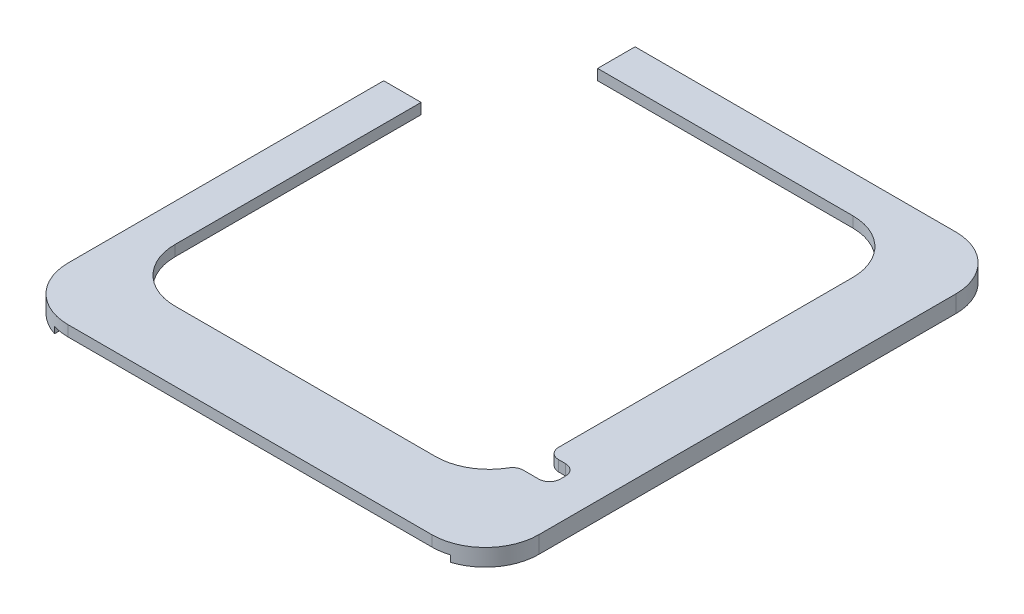
from build123d import *

# Parameters (mm, degrees)
SKETCH_2_W          = 7
SKETCH_2_H          = 10
EXTRUDE_1_DEPTH     = 1.2
SKETCH_2_W_2        = 5
SKETCH_2_H_2        = 7
EXTRUDE_1_2_DEPTH   = 1.2
SKETCH_2_W_3        = 12.3
SKETCH_2_H_3        = 16
EXTRUDE_1_3_DEPTH   = 1.2
EXTRUDE_1_4_DEPTH   = 1.2
EXTRUDE_1_5_DEPTH   = 1.2
EXTRUDE_2_DEPTH     = 2
SKETCH_4_W          = 18
SKETCH_4_H          = 29
CUT_EXTRUDE_1_DEPTH = 124.787075254
FILLET_1_R          = 10
FILLET_2_R          = 10
SKETCH_5_W          = 6.13484861
SKETCH_5_H          = 5
CUT_EXTRUDE_2_DEPTH = 124.787075254
FILLET_3_R          = 2
SKETCH_6_W          = 2.7
SKETCH_6_H          = 72
EXTRUDE_3_DEPTH     = 1.2
CUT_EXTRUDE_5_DEPTH = 0.6


# Some blends are built 0.0001 mm under size
with BuildPart() as part:
    # 草图2 → 凸台-拉伸1 (new body)
    with BuildSketch(Plane(origin=(0, 0, 0), x_dir=(1, 0, 0), z_dir=(0, 1, 0))):
        with Locations((3.5, 63)):
            Rectangle(SKETCH_2_W, SKETCH_2_H)
    extrude(amount=EXTRUDE_1_DEPTH)



with BuildPart() as body_2:
    # 草图2 → Extrude 1 2 (new body)
    with BuildSketch(Plane(origin=(0, 0, 0), x_dir=(1, 0, 0), z_dir=(0, 1, 0))):
        with Locations((15.5, 83.5)):
            Rectangle(SKETCH_2_W_2, SKETCH_2_H_2)
    extrude(amount=EXTRUDE_1_2_DEPTH)


with BuildPart() as body_3:
    # 草图2 → Extrude 1 3 (new body)
    with BuildSketch(Plane(origin=(0, 0, 0), x_dir=(1, 0, 0), z_dir=(0, 1, 0))):
        with Locations((81.85, 79)):
            Rectangle(SKETCH_2_W_3, SKETCH_2_H_3)
    extrude(amount=EXTRUDE_1_3_DEPTH)


with BuildPart() as body_4:
    # 草图2 → Extrude 1 4 (new body)
    with BuildSketch(Plane(origin=(0, 0, 0), x_dir=(1, 0, 0), z_dir=(0, 1, 0))):
        with Locations((3.5, -6)):
            Rectangle(SKETCH_2_W, SKETCH_2_H)
    extrude(amount=EXTRUDE_1_4_DEPTH)


with BuildPart() as body_5:
    # 草图2 → Extrude 1 5 (new body)
    with BuildSketch(Plane(origin=(0, 0, 0), x_dir=(1, 0, 0), z_dir=(0, 1, 0))):
        with Locations((84.5, -6)):
            Rectangle(SKETCH_2_W, SKETCH_2_H)
    extrude(amount=EXTRUDE_1_5_DEPTH)


with BuildPart() as part_1:
    add(part.part)

    add(body_2.part)  # 凸台-拉伸2 merges body 2

    add(body_3.part)  # 凸台-拉伸2 merges body 3

    add(body_4.part)  # 凸台-拉伸2 merges body 4

    add(body_5.part)  # 凸台-拉伸2 merges body 5
    # 草图3 → 凸台-拉伸2 (add)
    with BuildSketch(Plane(origin=(0, 1.2, 0), x_dir=(1, 0, 0), z_dir=(0, 1, 0))):
        Polygon((75.7, 71), (75.7, 2), (7, 2), (7, 58), (7, 68), (0, 68), (0, 58), (0, -1), (0, -11), (11.401754251, -11), (76.788875374, -11), (88, -11), (88, -1), (88, 71), (88, 87), (75.7, 87), (18, 87), (13, 87), (13, 80), (18, 80), (75.7, 80), align=None)
    extrude(amount=EXTRUDE_2_DEPTH)

    # 草图4 → 切除-拉伸1 (cut, through all)
    with BuildSketch(Plane.XZ):
        with Locations((9, -72.5)):
            Rectangle(SKETCH_4_W, SKETCH_4_H)
    extrude(amount=-CUT_EXTRUDE_1_DEPTH, mode=Mode.SUBTRACT)

    # 圆角1
    # the kernel refuses this fillet: 10 mm, written as the material it adds along each edge
    with BuildSketch(Plane(origin=(75.7, 1.2, -80), x_dir=(0, 0, 1), z_dir=(0, 1, 0)), Plane(origin=(7, 1.2, -2), x_dir=(0, 0, -1), z_dir=(0, 1, 0))) as fillet_1_piece_1:
        with BuildLine():
            CenterArc((FILLET_1_R, -FILLET_1_R), FILLET_1_R, 90, 90)
            Line((0, -FILLET_1_R), (0, 0))
            Line((0, 0), (FILLET_1_R, 0))
        make_face()
    extrude(amount=2)
    with BuildSketch(Plane(origin=(75.7, 1.2, -2), x_dir=(0, 0, -1), z_dir=(0, 1, 0))) as fillet_1_piece_2:
        with BuildLine():
            CenterArc((FILLET_1_R, FILLET_1_R), FILLET_1_R, 180, 90)
            Line((0, FILLET_1_R), (0, 0))
            Line((0, 0), (FILLET_1_R, 0))
        make_face()
    extrude(amount=2)

    # 圆角2
    fillet_2_edges = [part_1.edges().sort_by_distance(p)[0] for p in [
        (88, 1.6, -87),
        (0, 1.6, 11),
        (88, 1.6, 11),
    ]]
    fillet(fillet_2_edges, radius=FILLET_2_R - 0.0001)  # a hair under: the kernel refuses the full size

    # 草图5 → 切除-拉伸2 (cut, through all)
    with BuildSketch(Plane(origin=(0, 3.2, 0), x_dir=(1, 0, 0), z_dir=(0, 1, 0))):
        with Locations((77.932575695, 10.5)):
            Rectangle(SKETCH_5_W, SKETCH_5_H)
    extrude(amount=-CUT_EXTRUDE_2_DEPTH, mode=Mode.SUBTRACT)

    # 圆角3
    fillet_3_edges = [part_1.edges().sort_by_distance(p)[0] for p in [
        (74.86515139, 2.2, -8),
        (75.7, 2.2, -13),
        (81, 2.2, -13),
        (81, 2.2, -8),
    ]]
    fillet(fillet_3_edges, radius=FILLET_3_R)

    # 草图6 → 凸台-拉伸3 (add)
    with BuildSketch(Plane.XZ.offset(-1.2)):
        with Locations((86.65, -35)):
            Rectangle(SKETCH_6_W, SKETCH_6_H)
    extrude(amount=EXTRUDE_3_DEPTH)

    # 草图7 → 切除-拉伸5 (cut)
    # profile 1 of 15: a face of its own
    with BuildSketch(Plane(origin=(0, 1.2, 0), x_dir=(1, 0, 0), z_dir=(0, 1, 0))):
        with BuildLine():
            add(Edge.make_bspline(
                [(18.510765161, -2.972730973), (18.559720289, -2.974445621), (18.656752588, -2.977844168), (18.799322395, -3.005212975), (18.935489078, -3.051618244), (19.065369855, -3.114125833), (19.186392288, -3.194167035), (19.300631363, -3.286051516), (19.404471658, -3.393666032), (19.465539281, -3.4735266), (19.496520147, -3.514041514)],
                knots=[0, 0, 0, 0, 1.00426865, 1.990526802, 2.966146487, 3.949964669, 4.940067285, 5.937658965, 6.953731839, 8, 8, 8, 8], degree=3))
            Line((19.496520147, -3.514041514), (19.502218152, -3.448107448))
            Line((19.502218152, -3.448107448), (19.532336182, -3.027269027))
            Line((19.532336182, -3.027269027), (20.243772894, -3.027269027))
            Line((20.243772894, -3.027269027), (20.243772894, -6))
            Line((20.243772894, -6), (19.48024013, -6))
            Line((19.48024013, -6), (19.48024013, -4.214082214))
            add(Edge.make_bspline(
                [(19.48024013, -4.214082214), (19.461661523, -4.17404989), (19.425521948, -4.096178003), (19.351542282, -3.992712809), (19.262949694, -3.904370689), (19.192020907, -3.861876103), (19.156267806, -3.84045584)],
                knots=[0, 0, 0, 0, 1.048167327, 2.038921516, 3.011478428, 4, 4, 4, 4], degree=3))
            add(Edge.make_bspline(
                [(19.156267806, -3.84045584), (19.123316176, -3.824194422), (19.055098378, -3.790529374), (18.939902405, -3.759326253), (18.812108312, -3.739472931), (18.722221022, -3.737366034), (18.675193325, -3.736263736)],
                knots=[0, 0, 0, 0, 0.885042727, 1.832251298, 2.865866045, 4, 4, 4, 4], degree=3))
            add(Edge.make_bspline(
                [(18.675193325, -3.736263736), (18.626316777, -3.736944957), (18.525932536, -3.738344071), (18.37362468, -3.753505421), (18.218629542, -3.773754972), (18.116381034, -3.79655268), (18.065506716, -3.807895808)],
                knots=[0, 0, 0, 0, 0.95309603, 1.957499557, 2.983742445, 4, 4, 4, 4], degree=3))
            Line((18.065506716, -3.807895808), (17.953174603, -3.046805047))
            add(Edge.make_bspline(
                [(17.953174603, -3.046805047), (17.96941445, -3.042042863), (18.003845981, -3.031946138), (18.059829051, -3.019011415), (18.122867513, -3.007069657), (18.218173767, -2.991672191), (18.347989978, -2.975126447), (18.455073508, -2.973550557), (18.510765161, -2.972730973)],
                knots=[0, 0, 0, 0, 0.539787281, 1.144450548, 1.831968336, 2.586160082, 4.224541291, 6, 6, 6, 6], degree=3))
        make_face()
    # profile 2 of 15: a face of its own
    with BuildSketch(Plane(origin=(0, 1.2, 0), x_dir=(1, 0, 0), z_dir=(0, 1, 0))):
        with BuildLine():
            add(Edge.make_bspline(
                [(22.588909239, -6.054538055), (22.553618335, -6.054157216), (22.484023978, -6.053406195), (22.38133849, -6.044816418), (22.282162968, -6.031961653), (22.186605903, -6.014386772), (22.095144466, -5.990369526), (22.006863525, -5.962136795), (21.922336853, -5.927932598), (21.816969586, -5.876487618), (21.697149892, -5.806201812), (21.570402311, -5.715312657), (21.463182677, -5.620161615), (21.407123996, -5.548543266), (21.38011803, -5.514041514)],
                knots=[0, 0, 0, 0, 0.925770377, 1.825637414, 2.701643766, 3.549213054, 4.372883542, 5.181148833, 5.9796667, 6.762964154, 8.25629436, 9.617741739, 10.852359996, 12, 12, 12, 12], degree=3))
            Line((21.38011803, -5.514041514), (21.761884412, -5.101343101))
            add(Edge.make_bspline(
                [(21.761884412, -5.101343101), (21.784807361, -5.128577298), (21.83066927, -5.183064716), (21.912189827, -5.253571185), (22.004342703, -5.312275396), (22.104875652, -5.35996595), (22.211257521, -5.395587158), (22.319938962, -5.423313107), (22.430829257, -5.43863343), (22.505296728, -5.441151206), (22.542511193, -5.442409442)],
                knots=[0, 0, 0, 0, 0.968292131, 1.93726064, 2.921075072, 3.935732918, 4.959203909, 5.971734107, 6.986391953, 8, 8, 8, 8], degree=3))
            add(Edge.make_bspline(
                [(22.542511193, -5.442409442), (22.568584647, -5.441739951), (22.619801317, -5.440424855), (22.695277235, -5.431340931), (22.767593799, -5.416183807), (22.836416965, -5.393881853), (22.901627885, -5.366036445), (22.963561334, -5.33359838), (23.021913166, -5.296014796), (23.057743891, -5.267181823), (23.075681726, -5.252747253)],
                knots=[0, 0, 0, 0, 1.08232958, 2.12604423, 3.151174937, 4.145070927, 5.124239811, 6.091675454, 7.044640867, 8, 8, 8, 8], degree=3))
            add(Edge.make_bspline(
                [(23.075681726, -5.252747253), (23.107244847, -5.222883892), (23.169211591, -5.164254227), (23.229954033, -5.075154542), (23.268024362, -4.996139378), (23.29378016, -4.928240963), (23.317479829, -4.851912679), (23.329763293, -4.797549562), (23.336161986, -4.769230769)],
                knots=[0, 0, 0, 0, 1.393511036, 2.735830271, 3.433894047, 4.209552534, 5.067321514, 6, 6, 6, 6], degree=3))
            Line((23.336161986, -4.769230769), (23.336161986, -4.761090761))
            Line((23.336161986, -4.761090761), (21.31988197, -4.761090761))
            Line((21.31988197, -4.761090761), (21.31988197, -4.437118437))
            add(Edge.make_bspline(
                [(21.31988197, -4.437118437), (21.320927303, -4.383617997), (21.322975784, -4.278776164), (21.340475434, -4.125242278), (21.368685905, -3.978963656), (21.408589767, -3.840336473), (21.459097506, -3.709887759), (21.519022489, -3.588166735), (21.589828116, -3.476062006), (21.646049765, -3.409522374), (21.673972324, -3.376475376)],
                knots=[0, 0, 0, 0, 1.122970953, 2.20062363, 3.239654839, 4.247531543, 5.225053915, 6.172790854, 7.092514104, 8, 8, 8, 8], degree=3))
            add(Edge.make_bspline(
                [(21.673972324, -3.376475376), (21.704305049, -3.345718659), (21.765035725, -3.284139085), (21.867244724, -3.203051029), (21.980226962, -3.134786537), (22.101405937, -3.075713934), (22.232190822, -3.029430583), (22.371779466, -2.995815091), (22.520250576, -2.976335204), (22.622225885, -2.973950557), (22.674379324, -2.972730973)],
                knots=[0, 0, 0, 0, 0.932380712, 1.866766408, 2.808455035, 3.778168738, 4.773465388, 5.798203766, 6.873930868, 8, 8, 8, 8], degree=3))
            add(Edge.make_bspline(
                [(22.674379324, -2.972730973), (22.725172755, -2.97427861), (22.825270503, -2.977328513), (22.972603339, -2.997280297), (23.113464729, -3.034173844), (23.248559801, -3.082226797), (23.375820288, -3.144758518), (23.495040225, -3.217827187), (23.605400482, -3.30299039), (23.671094178, -3.368161637), (23.704090354, -3.400895401)],
                knots=[0, 0, 0, 0, 1.063104521, 2.095041956, 3.103191733, 4.105503437, 5.090878926, 6.064799998, 7.028001121, 8, 8, 8, 8], degree=3))
            add(Edge.make_bspline(
                [(23.704090354, -3.400895401), (23.735245376, -3.435818862), (23.797839922, -3.505984701), (23.878384021, -3.623334427), (23.947475523, -3.75054956), (24.007291727, -3.886023684), (24.053644938, -4.03093962), (24.086554525, -4.183327426), (24.107813945, -4.34318232), (24.109983083, -4.452243865), (24.111090761, -4.507936508)],
                knots=[0, 0, 0, 0, 0.928831954, 1.866145857, 2.818826586, 3.801047347, 4.803173288, 5.834887371, 6.894377997, 8, 8, 8, 8], degree=3))
            Line((24.111090761, -4.507936508), (24.111090761, -4.617826618))
            add(Edge.make_bspline(
                [(24.111090761, -4.617826618), (24.109917744, -4.667007757), (24.107593788, -4.764444375), (24.086657457, -4.908193557), (24.052328574, -5.047155013), (24.005192321, -5.180878312), (23.945365531, -5.307611015), (23.872523016, -5.425660045), (23.790413139, -5.536521113), (23.72580166, -5.601857835), (23.693508344, -5.634513635)],
                knots=[0, 0, 0, 0, 1.044469973, 2.069281507, 3.078785392, 4.081617092, 5.076997636, 6.049887288, 7.025318574, 8, 8, 8, 8], degree=3))
            add(Edge.make_bspline(
                [(23.693508344, -5.634513635), (23.659236281, -5.666344326), (23.590388788, -5.730287465), (23.472943436, -5.810509869), (23.348442866, -5.884276626), (23.21287286, -5.944803926), (23.068612283, -5.994047409), (22.915553716, -6.028690023), (22.754770975, -6.050357271), (22.644873951, -6.053127384), (22.588909239, -6.054538055)],
                knots=[0, 0, 0, 0, 0.925143054, 1.85847523, 2.80967551, 3.788571406, 4.792920861, 5.824070915, 6.891914993, 8, 8, 8, 8], degree=3))
        make_face()
        with BuildLine():
            add(Edge.make_bspline(
                [(22.68007733, -3.590557591), (22.656431556, -3.590838025), (22.610312683, -3.591384986), (22.543701572, -3.60106504), (22.480899334, -3.614152188), (22.405664823, -3.64164817), (22.318846232, -3.683835886), (22.262373462, -3.733842293), (22.234818885, -3.758241758)],
                knots=[0, 0, 0, 0, 0.870796138, 1.698406502, 2.477437244, 3.230406908, 4.648641342, 6, 6, 6, 6], degree=3))
            add(Edge.make_bspline(
                [(22.234818885, -3.758241758), (22.210434229, -3.786097085), (22.161006114, -3.842560307), (22.110887277, -3.944837852), (22.074706964, -4.05566619), (22.071304576, -4.133735653), (22.06957672, -4.173382173)],
                knots=[0, 0, 0, 0, 0.966911438, 1.959946007, 2.963986173, 4, 4, 4, 4], degree=3))
            Line((22.06957672, -4.173382173), (22.06957672, -4.233618234))
            Line((22.06957672, -4.233618234), (23.322323972, -4.233618234))
            add(Edge.make_bspline(
                [(23.322323972, -4.233618234), (23.312077642, -4.18689831), (23.292309908, -4.09676389), (23.244788013, -3.970631439), (23.182854267, -3.859144786), (23.128867948, -3.796787646), (23.102543753, -3.766381766)],
                knots=[0, 0, 0, 0, 1.095344216, 2.11319302, 3.079976638, 4, 4, 4, 4], degree=3))
            add(Edge.make_bspline(
                [(23.102543753, -3.766381766), (23.08891906, -3.752867836), (23.061725628, -3.725895474), (23.017239598, -3.689460253), (22.967601346, -3.660858416), (22.916033632, -3.634931487), (22.860994069, -3.61448549), (22.802640309, -3.601253804), (22.742271339, -3.591433012), (22.701011997, -3.59085226), (22.68007733, -3.590557591)],
                knots=[0, 0, 0, 0, 0.977751909, 1.951488393, 2.9188248, 3.889514203, 4.891116046, 5.900416418, 6.934687739, 8, 8, 8, 8], degree=3))
        make_face(mode=Mode.SUBTRACT)
    # profile 3 of 15: a face of its own
    with BuildSketch(Plane(origin=(0, 1.2, 0), x_dir=(1, 0, 0), z_dir=(0, 1, 0))):
        Polygon((26.057366707, -3.956043956), (26.70042735, -3.027269027), (27.521754172, -3.027269027), (26.527859178, -4.485958486), (27.560826211, -6), (26.733801384, -6), (26.054924705, -5.027269027), (25.371164021, -6), (24.546581197, -6), (25.57954823, -4.485958486), (24.582397232, -3.027269027), (25.403724054, -3.027269027), align=None)
    # profile 4 of 15: a face of its own
    with BuildSketch(Plane(origin=(0, 1.2, 0), x_dir=(1, 0, 0), z_dir=(0, 1, 0))):
        Polygon((30.60030525, -3.027269027), (30.60030525, -3.650793651), (29.754558405, -3.650793651), (29.754558405, -5.378917379), (30.60030525, -5.378917379), (30.60030525, -6), (28.177838828, -6), (28.177838828, -5.378917379), (28.982071632, -5.378917379), (28.982071632, -3.027269027), align=None)
    # profile 5 of 15: a face of its own
    with BuildSketch(Plane(origin=(0, 1.2, 0), x_dir=(1, 0, 0), z_dir=(0, 1, 0))):
        with BuildLine():
            add(Edge.make_bspline(
                [(29.809096459, -2.266178266), (29.807460751, -2.294559154), (29.804244432, -2.350364952), (29.781031209, -2.430014106), (29.743400517, -2.501432654), (29.706687435, -2.539071821), (29.688624339, -2.557590558)],
                knots=[0, 0, 0, 0, 1.049081676, 2.062826266, 3.046896788, 4, 4, 4, 4], degree=3))
            add(Edge.make_bspline(
                [(29.688624339, -2.557590558), (29.668089813, -2.574809184), (29.626184314, -2.609947816), (29.549242843, -2.646140932), (29.462623517, -2.669563341), (29.40117364, -2.671949931), (29.36953602, -2.673178673)],
                knots=[0, 0, 0, 0, 0.922264153, 1.882095614, 2.90959169, 4, 4, 4, 4], degree=3))
            add(Edge.make_bspline(
                [(29.36953602, -2.673178673), (29.337406319, -2.671803169), (29.275644856, -2.6691591), (29.187999523, -2.648207477), (29.111181043, -2.611459071), (29.045586341, -2.561732467), (28.993046962, -2.500178723), (28.954937076, -2.429461897), (28.931115987, -2.350439272), (28.928752169, -2.294840462), (28.927533578, -2.266178266)],
                knots=[0, 0, 0, 0, 1.141013215, 2.193317794, 3.176571943, 4.146547589, 5.097162428, 6.029011987, 6.983919884, 8, 8, 8, 8], degree=3))
            add(Edge.make_bspline(
                [(28.927533578, -2.266178266), (28.928717939, -2.237506599), (28.931004584, -2.182150272), (28.955121849, -2.103495176), (28.993030473, -2.032987202), (29.045590894, -1.971439339), (29.111179797, -1.921711114), (29.187999883, -1.884963157), (29.275644755, -1.864011405), (29.337406284, -1.861367354), (29.36953602, -1.85999186)],
                knots=[0, 0, 0, 0, 1.017255597, 1.964013175, 2.896940771, 3.848655357, 4.819753147, 5.804144802, 6.85766677, 8, 8, 8, 8], degree=3))
            add(Edge.make_bspline(
                [(29.36953602, -1.85999186), (29.401176356, -1.861208661), (29.462631508, -1.86357206), (29.54909903, -1.887125876), (29.625623725, -1.922470922), (29.668006365, -1.956008752), (29.688624339, -1.972323972)],
                knots=[0, 0, 0, 0, 1.096149104, 2.129054753, 3.089837262, 4, 4, 4, 4], degree=3))
            add(Edge.make_bspline(
                [(29.688624339, -1.972323972), (29.706650771, -1.991706238), (29.743018659, -2.030809488), (29.780742865, -2.102697181), (29.80436412, -2.182229884), (29.807496141, -2.237789744), (29.809096459, -2.266178266)],
                knots=[0, 0, 0, 0, 0.970522286, 1.958005104, 2.956634926, 4, 4, 4, 4], degree=3))
        make_face()
    # profile 6 of 15: a face of its own
    with BuildSketch(Plane(origin=(0, 1.2, 0), x_dir=(1, 0, 0), z_dir=(0, 1, 0))):
        Polygon((31.678856329, -4.343508344), (31.678856329, -3.716727717), (33.393142043, -3.716727717), (33.393142043, -2.629222629), (31.464774115, -2.629222629), (31.464774115, -2), (34.168070818, -2), (34.168070818, -6), (33.393142043, -6), (33.393142043, -4.343508344), align=None)
    # profile 7 of 15: a face of its own
    with BuildSketch(Plane(origin=(0, 1.2, 0), x_dir=(1, 0, 0), z_dir=(0, 1, 0))):
        with BuildLine():
            Line((41.042307692, -4.491656492), (41.042307692, -4.549450549))
            add(Edge.make_bspline(
                [(41.042307692, -4.549450549), (41.041504315, -4.60240662), (41.039922822, -4.706653572), (41.02341922, -4.859911099), (40.999885109, -5.007848488), (40.96454665, -5.148894135), (40.921438116, -5.282751206), (40.867113009, -5.406541235), (40.80579095, -5.521940826), (40.756519444, -5.591836661), (40.732173382, -5.626373626)],
                knots=[0, 0, 0, 0, 1.114797151, 2.194539839, 3.242921125, 4.267103555, 5.253726722, 6.200630871, 7.110894805, 8, 8, 8, 8], degree=3))
            add(Edge.make_bspline(
                [(40.732173382, -5.626373626), (40.706553866, -5.658469053), (40.655771003, -5.722088427), (40.567666878, -5.806118931), (40.471910361, -5.879795505), (40.368403908, -5.943131585), (40.256445256, -5.992724704), (40.137359517, -6.028924276), (40.010925171, -6.05034258), (39.924224303, -6.053119082), (39.87991453, -6.054538055)],
                knots=[0, 0, 0, 0, 0.994172767, 1.970643712, 2.941142302, 3.917613248, 4.90359979, 5.899857416, 6.926690765, 8, 8, 8, 8], degree=3))
            add(Edge.make_bspline(
                [(39.87991453, -6.054538055), (39.839392861, -6.053686656), (39.760329265, -6.052025456), (39.646174838, -6.032078818), (39.538752462, -6.00377447), (39.439797642, -5.960336884), (39.347287486, -5.907310735), (39.261677866, -5.844093026), (39.181601532, -5.77216544), (39.134533786, -5.717543535), (39.110683761, -5.68986569)],
                knots=[0, 0, 0, 0, 1.101140162, 2.148482586, 3.144267539, 4.11648798, 5.078821032, 6.040020862, 7.006845344, 8, 8, 8, 8], degree=3))
            Line((39.110683761, -5.68986569), (39.072425722, -6))
            Line((39.072425722, -6), (38.382967033, -6))
            Line((38.382967033, -6), (38.382967033, -1.78021978))
            Line((38.382967033, -1.78021978), (39.1497558, -1.78021978))
            Line((39.1497558, -1.78021978), (39.1497558, -3.294261294))
            add(Edge.make_bspline(
                [(39.1497558, -3.294261294), (39.172928259, -3.269676898), (39.218819958, -3.220988943), (39.29471571, -3.156154532), (39.376954606, -3.101771468), (39.463424638, -3.054684572), (39.556435291, -3.017442623), (39.656614482, -2.991996855), (39.763469596, -2.974890318), (39.837245019, -2.973462339), (39.875030525, -2.972730973)],
                knots=[0, 0, 0, 0, 0.989130309, 1.958914611, 2.915551243, 3.872055815, 4.838708826, 5.84109621, 6.894275772, 8, 8, 8, 8], degree=3))
            add(Edge.make_bspline(
                [(39.875030525, -2.972730973), (39.919899875, -2.973758024), (40.007725851, -2.975768344), (40.135396097, -2.998088775), (40.255999263, -3.031511146), (40.368142981, -3.080545199), (40.473076258, -3.140394485), (40.568394361, -3.214206577), (40.657658342, -3.296974197), (40.708775738, -3.360595214), (40.734615385, -3.392755393)],
                knots=[0, 0, 0, 0, 1.082656768, 2.119161275, 3.121130112, 4.098731911, 5.067728088, 6.031167411, 7.004762719, 8, 8, 8, 8], degree=3))
            add(Edge.make_bspline(
                [(40.734615385, -3.392755393), (40.758997308, -3.427269646), (40.808617268, -3.497510037), (40.869700934, -3.614088965), (40.922786467, -3.739880071), (40.966485567, -3.874984524), (41.000611841, -4.018719108), (41.024604493, -4.170017761), (41.039667453, -4.328550921), (41.041415524, -4.43654117), (41.042307692, -4.491656492)],
                knots=[0, 0, 0, 0, 0.873127021, 1.776911794, 2.714907838, 3.694466646, 4.709825059, 5.767055702, 6.860365238, 8, 8, 8, 8], degree=3))
        make_face()
        with BuildLine():
            Line((40.278774929, -4.549450549), (40.278774929, -4.491656492))
            add(Edge.make_bspline(
                [(40.278774929, -4.491656492), (40.277297379, -4.431335564), (40.274422551, -4.313970753), (40.253614283, -4.170732213), (40.228928073, -4.063099027), (40.204249265, -3.988771212), (40.176221381, -3.918692538), (40.152753481, -3.875528011), (40.141208791, -3.854293854)],
                knots=[0, 0, 0, 0, 1.64659124, 3.2037284, 3.94238429, 4.659391249, 5.340507156, 6, 6, 6, 6], degree=3))
            add(Edge.make_bspline(
                [(40.141208791, -3.854293854), (40.128904892, -3.834981295), (40.10449249, -3.796662876), (40.060442884, -3.745443866), (40.010715548, -3.700885388), (39.956116594, -3.662340897), (39.895553646, -3.630874978), (39.828680091, -3.609342029), (39.756285154, -3.594615519), (39.70579777, -3.593550662), (39.67967033, -3.592999593)],
                knots=[0, 0, 0, 0, 0.985881017, 1.956105478, 2.899972441, 3.856930312, 4.829617722, 5.827970456, 6.875965264, 8, 8, 8, 8], degree=3))
            add(Edge.make_bspline(
                [(39.67967033, -3.592999593), (39.648380643, -3.593702227), (39.588047977, -3.595057042), (39.502128104, -3.61195482), (39.424193174, -3.637654069), (39.35475708, -3.674903798), (39.293399981, -3.722344224), (39.237658315, -3.776841549), (39.188766743, -3.840405743), (39.162963108, -3.887819631), (39.1497558, -3.912087912)],
                knots=[0, 0, 0, 0, 1.144389556, 2.206608035, 3.193396821, 4.140402505, 5.076552545, 6.025225311, 6.989233137, 8, 8, 8, 8], degree=3))
            Line((39.1497558, -3.912087912), (39.1497558, -5.115181115))
            add(Edge.make_bspline(
                [(39.1497558, -5.115181115), (39.162981444, -5.138908576), (39.189119448, -5.185801452), (39.238526681, -5.248522806), (39.294214624, -5.303635758), (39.356664259, -5.350625648), (39.426782498, -5.388916488), (39.505756596, -5.415643217), (39.593073223, -5.430879189), (39.653832466, -5.433111038), (39.685368335, -5.434269434)],
                knots=[0, 0, 0, 0, 0.987352076, 1.951316178, 2.89400397, 3.832129172, 4.78653676, 5.788983242, 6.85241598, 8, 8, 8, 8], degree=3))
            add(Edge.make_bspline(
                [(39.685368335, -5.434269434), (39.711483854, -5.433642569), (39.761898135, -5.432432447), (39.834322953, -5.418768328), (39.900975359, -5.398152216), (39.961228004, -5.367456203), (40.01477676, -5.328758763), (40.063765118, -5.28427155), (40.106896529, -5.23279122), (40.131302405, -5.194693224), (40.143650794, -5.175417175)],
                knots=[0, 0, 0, 0, 1.13071954, 2.18277929, 3.183412007, 4.146061051, 5.099104669, 6.039874946, 7.0082558, 8, 8, 8, 8], degree=3))
            add(Edge.make_bspline(
                [(40.143650794, -5.175417175), (40.155155387, -5.154991569), (40.178538038, -5.113477296), (40.207139741, -5.046178885), (40.229338207, -4.973384293), (40.255004992, -4.868132014), (40.274006828, -4.725934504), (40.277153322, -4.609471844), (40.278774929, -4.549450549)],
                knots=[0, 0, 0, 0, 0.651061411, 1.323257734, 2.026693217, 2.763633848, 4.332075826, 6, 6, 6, 6], degree=3))
        make_face(mode=Mode.SUBTRACT)
    # profile 8 of 15: a face of its own
    with BuildSketch(Plane(origin=(0, 1.2, 0), x_dir=(1, 0, 0), z_dir=(0, 1, 0))):
        Polygon((44.145278795, -3.027269027), (44.145278795, -3.650793651), (43.29953195, -3.650793651), (43.29953195, -5.378917379), (44.145278795, -5.378917379), (44.145278795, -6), (41.722812373, -6), (41.722812373, -5.378917379), (42.527045177, -5.378917379), (42.527045177, -3.027269027), align=None)
    # profile 9 of 15: a face of its own
    with BuildSketch(Plane(origin=(0, 1.2, 0), x_dir=(1, 0, 0), z_dir=(0, 1, 0))):
        with BuildLine():
            add(Edge.make_bspline(
                [(43.354070004, -2.266178266), (43.352434296, -2.294559154), (43.349217977, -2.350364952), (43.326004754, -2.430014106), (43.288374062, -2.501432654), (43.25166098, -2.539071821), (43.233597884, -2.557590558)],
                knots=[0, 0, 0, 0, 1.049081676, 2.062826266, 3.046896788, 4, 4, 4, 4], degree=3))
            add(Edge.make_bspline(
                [(43.233597884, -2.557590558), (43.213063358, -2.574809184), (43.171157859, -2.609947816), (43.094216388, -2.646140932), (43.007597062, -2.669563341), (42.946147185, -2.671949931), (42.914509565, -2.673178673)],
                knots=[0, 0, 0, 0, 0.922264153, 1.882095614, 2.90959169, 4, 4, 4, 4], degree=3))
            add(Edge.make_bspline(
                [(42.914509565, -2.673178673), (42.882379864, -2.671803169), (42.820618401, -2.6691591), (42.732973068, -2.648207477), (42.656154588, -2.611459071), (42.590559886, -2.561732467), (42.538020507, -2.500178723), (42.499910621, -2.429461897), (42.476089532, -2.350439272), (42.473725714, -2.294840462), (42.472507123, -2.266178266)],
                knots=[0, 0, 0, 0, 1.141013215, 2.193317794, 3.176571943, 4.146547589, 5.097162428, 6.029011987, 6.983919884, 8, 8, 8, 8], degree=3))
            add(Edge.make_bspline(
                [(42.472507123, -2.266178266), (42.473691484, -2.237506599), (42.475978129, -2.182150272), (42.500095394, -2.103495176), (42.538004018, -2.032987202), (42.590564439, -1.971439339), (42.656153342, -1.921711114), (42.732973428, -1.884963157), (42.8206183, -1.864011405), (42.882379829, -1.861367354), (42.914509565, -1.85999186)],
                knots=[0, 0, 0, 0, 1.017255597, 1.964013175, 2.896940771, 3.848655357, 4.819753147, 5.804144802, 6.85766677, 8, 8, 8, 8], degree=3))
            add(Edge.make_bspline(
                [(42.914509565, -1.85999186), (42.946149901, -1.861208661), (43.007605053, -1.86357206), (43.094072575, -1.887125876), (43.17059727, -1.922470922), (43.21297991, -1.956008752), (43.233597884, -1.972323972)],
                knots=[0, 0, 0, 0, 1.096149104, 2.129054753, 3.089837262, 4, 4, 4, 4], degree=3))
            add(Edge.make_bspline(
                [(43.233597884, -1.972323972), (43.251624316, -1.991706238), (43.287992204, -2.030809488), (43.32571641, -2.102697181), (43.349337665, -2.182229884), (43.352469686, -2.237789744), (43.354070004, -2.266178266)],
                knots=[0, 0, 0, 0, 0.970522286, 1.958005104, 2.956634926, 4, 4, 4, 4], degree=3))
        make_face()
    # profile 10 of 15: a face of its own
    with BuildSketch(Plane(origin=(0, 1.2, 0), x_dir=(1, 0, 0), z_dir=(0, 1, 0))):
        with BuildLine():
            Line((47.839214489, -4.485958486), (47.839214489, -4.543752544))
            add(Edge.make_bspline(
                [(47.839214489, -4.543752544), (47.838269542, -4.597266083), (47.836412475, -4.702434069), (47.817318408, -4.856873271), (47.789884343, -5.005282005), (47.748714789, -5.146547686), (47.697045984, -5.280362373), (47.633260237, -5.405098328), (47.55912085, -5.521543787), (47.500568521, -5.591425386), (47.471286121, -5.626373626)],
                knots=[0, 0, 0, 0, 1.097957229, 2.157770801, 3.190062059, 4.19308757, 5.173638154, 6.130181546, 7.064891673, 8, 8, 8, 8], degree=3))
            add(Edge.make_bspline(
                [(47.471286121, -5.626373626), (47.440583598, -5.659209546), (47.37913541, -5.724927525), (47.272568165, -5.809126109), (47.157216378, -5.884222956), (47.030751443, -5.946748464), (46.894298608, -5.99647001), (46.748353077, -6.032366187), (46.593331578, -6.053566069), (46.486954007, -6.056364661), (46.432621083, -6.057794058)],
                knots=[0, 0, 0, 0, 0.928831053, 1.858967251, 2.800969092, 3.772479409, 4.770483341, 5.799728561, 6.876199351, 8, 8, 8, 8], degree=3))
            add(Edge.make_bspline(
                [(46.432621083, -6.057794058), (46.378554154, -6.056400271), (46.273244263, -6.053685496), (46.119628682, -6.032156441), (45.975218709, -5.996634497), (45.839928798, -5.94661418), (45.714260596, -5.883776686), (45.598460559, -5.809411621), (45.491827324, -5.724891951), (45.43036409, -5.659197694), (45.39965405, -5.626373626)],
                knots=[0, 0, 0, 0, 1.123611424, 2.188535583, 3.217293366, 4.20954456, 5.1807142, 6.132024807, 7.066668138, 8, 8, 8, 8], degree=3))
            add(Edge.make_bspline(
                [(45.39965405, -5.626373626), (45.370964927, -5.591381329), (45.313477895, -5.521264047), (45.240021005, -5.405112944), (45.17732685, -5.280143711), (45.125353307, -5.146589623), (45.084591352, -5.005169926), (45.055772443, -4.85698429), (45.03704807, -4.702418434), (45.035139062, -4.59726081), (45.034167684, -4.543752544)],
                knots=[0, 0, 0, 0, 0.92950485, 1.862534265, 2.817920483, 3.799868555, 4.804323587, 5.839153926, 6.900477953, 8, 8, 8, 8], degree=3))
            Line((45.034167684, -4.543752544), (45.034167684, -4.485958486))
            add(Edge.make_bspline(
                [(45.034167684, -4.485958486), (45.035149939, -4.432993515), (45.037085036, -4.328649528), (45.055753245, -4.175158882), (45.084706621, -4.027549615), (45.12534258, -3.886375183), (45.177329613, -3.752823896), (45.240020296, -3.627853942), (45.31347807, -3.511703022), (45.370964985, -3.441585716), (45.39965405, -3.406593407)],
                knots=[0, 0, 0, 0, 1.091396696, 2.150113154, 3.182331507, 4.1895766, 5.174252216, 6.132292198, 7.067913277, 8, 8, 8, 8], degree=3))
            add(Edge.make_bspline(
                [(45.39965405, -3.406593407), (45.431024145, -3.373899853), (45.493661657, -3.308619755), (45.599842199, -3.22233426), (45.716634057, -3.148663321), (45.842687938, -3.085421285), (45.978219885, -3.034909039), (46.123274716, -2.997940643), (46.27788856, -2.976980094), (46.383989921, -2.974169921), (46.438319088, -2.972730973)],
                knots=[0, 0, 0, 0, 0.936395595, 1.869726278, 2.820835012, 3.78697061, 4.781292913, 5.806086311, 6.876607213, 8, 8, 8, 8], degree=3))
            add(Edge.make_bspline(
                [(46.438319088, -2.972730973), (46.492649178, -2.974167493), (46.59875234, -2.976972923), (46.753353343, -2.997967279), (46.898207254, -3.034752279), (47.033122597, -3.0854797), (47.158293334, -3.148411391), (47.273631546, -3.222648105), (47.378914004, -3.308376206), (47.440500849, -3.373860117), (47.471286121, -3.406593407)],
                knots=[0, 0, 0, 0, 1.127899569, 2.202715142, 3.231619765, 4.22465531, 5.18963108, 6.135068752, 7.067781155, 8, 8, 8, 8], degree=3))
            add(Edge.make_bspline(
                [(47.471286121, -3.406593407), (47.500568465, -3.441541658), (47.559120682, -3.51142328), (47.633260912, -3.62786857), (47.697043358, -3.752605187), (47.748724958, -3.886417309), (47.789770404, -4.027436721), (47.817337964, -4.175270422), (47.836374982, -4.328633917), (47.838258444, -4.432988258), (47.839214489, -4.485958486)],
                knots=[0, 0, 0, 0, 0.937702725, 1.875006145, 2.834203406, 3.817474464, 4.823282805, 5.852953804, 6.910160091, 8, 8, 8, 8], degree=3))
        make_face()
        with BuildLine():
            Line((47.075681726, -4.543752544), (47.075681726, -4.485958486))
            add(Edge.make_bspline(
                [(47.075681726, -4.485958486), (47.074053931, -4.427240102), (47.070863375, -4.312149247), (47.047585137, -4.171435023), (47.021125765, -4.064864787), (46.994435429, -3.990966147), (46.965113721, -3.920839514), (46.939956021, -3.877925878), (46.927533578, -3.856735857)],
                knots=[0, 0, 0, 0, 1.614668026, 3.164826938, 3.912659052, 4.632812843, 5.32490629, 6, 6, 6, 6], degree=3))
            add(Edge.make_bspline(
                [(46.927533578, -3.856735857), (46.914188104, -3.83682277), (46.887992336, -3.797735461), (46.840445095, -3.745953942), (46.788312253, -3.69995101), (46.730107602, -3.660800796), (46.666321913, -3.628064155), (46.595361486, -3.60700054), (46.518981129, -3.592160669), (46.46580279, -3.591103802), (46.438319088, -3.590557591)],
                knots=[0, 0, 0, 0, 0.984539217, 1.93254754, 2.881474794, 3.837786807, 4.810877504, 5.816686224, 6.871616815, 8, 8, 8, 8], degree=3))
            add(Edge.make_bspline(
                [(46.438319088, -3.590557591), (46.410570107, -3.591132834), (46.356597435, -3.592251702), (46.279335737, -3.606771676), (46.207873571, -3.628079956), (46.144102557, -3.660808763), (46.085829784, -3.699904835), (46.033815486, -3.746251261), (45.985301041, -3.797227729), (45.959642048, -3.836745847), (45.946662597, -3.856735857)],
                knots=[0, 0, 0, 0, 1.1346745, 2.206978875, 3.208503532, 4.177449523, 5.129688296, 6.074573764, 7.026034353, 8, 8, 8, 8], degree=3))
            add(Edge.make_bspline(
                [(45.946662597, -3.856735857), (45.934514615, -3.87793245), (45.909899256, -3.920882941), (45.881342874, -3.990981258), (45.855702536, -4.065021106), (45.828924422, -4.171392406), (45.805817745, -4.312163476), (45.802598753, -4.427244909), (45.800956451, -4.485958486)],
                knots=[0, 0, 0, 0, 0.672500229, 1.362681959, 2.081470521, 2.830424658, 4.382909378, 6, 6, 6, 6], degree=3))
            Line((45.800956451, -4.485958486), (45.800956451, -4.543752544))
            add(Edge.make_bspline(
                [(45.800956451, -4.543752544), (45.802564902, -4.604364294), (45.805690532, -4.722148356), (45.828728082, -4.865670506), (45.855572009, -4.972604295), (45.881350723, -5.046063823), (45.909901211, -5.11536078), (45.934514365, -5.157750853), (45.946662597, -5.178673179)],
                knots=[0, 0, 0, 0, 1.654496605, 3.215108092, 3.957392515, 4.662769628, 5.339987705, 6, 6, 6, 6], degree=3))
            add(Edge.make_bspline(
                [(45.946662597, -5.178673179), (45.959692585, -5.198616369), (45.985561234, -5.238209912), (46.033517989, -5.289983946), (46.08590096, -5.336212711), (46.143863654, -5.375627595), (46.207686608, -5.406766212), (46.277619271, -5.42877623), (46.353078296, -5.443074898), (46.405691603, -5.444249989), (46.432621083, -5.444851445)],
                knots=[0, 0, 0, 0, 0.982941313, 1.951449563, 2.905042706, 3.866056919, 4.838969269, 5.828349479, 6.88846718, 8, 8, 8, 8], degree=3))
            add(Edge.make_bspline(
                [(46.432621083, -5.444851445), (46.46064487, -5.444313385), (46.514628075, -5.443276901), (46.592125459, -5.428473173), (46.663628821, -5.407148281), (46.728642038, -5.375571127), (46.787378251, -5.336469193), (46.83988236, -5.289980412), (46.887783701, -5.237998391), (46.914189785, -5.198588293), (46.927533578, -5.178673179)],
                knots=[0, 0, 0, 0, 1.140120022, 2.196253187, 3.203391134, 4.17261518, 5.129335862, 6.069560123, 7.024490388, 8, 8, 8, 8], degree=3))
            add(Edge.make_bspline(
                [(46.927533578, -5.178673179), (46.939956194, -5.157757461), (46.965111226, -5.115404422), (46.994427713, -5.046079189), (47.021257737, -4.972762801), (47.047778019, -4.865626263), (47.070992799, -4.722163481), (47.074088616, -4.604369433), (47.075681726, -4.543752544)],
                knots=[0, 0, 0, 0, 0.66262647, 1.341777794, 2.048541493, 2.789712881, 4.34798427, 6, 6, 6, 6], degree=3))
        make_face(mode=Mode.SUBTRACT)
    # profile 11 of 15: a face of its own
    with BuildSketch(Plane(origin=(0, 1.2, 0), x_dir=(1, 0, 0), z_dir=(0, 1, 0))):
        with BuildLine():
            add(Edge.make_bspline(
                [(48.986955637, -2.972730973), (49.035910766, -2.974445621), (49.132943064, -2.977844168), (49.275512871, -3.005212975), (49.411679554, -3.051618244), (49.541560331, -3.114125833), (49.662582764, -3.194167035), (49.776821839, -3.286051516), (49.880662134, -3.393666032), (49.941729757, -3.4735266), (49.972710623, -3.514041514)],
                knots=[0, 0, 0, 0, 1.00426865, 1.990526802, 2.966146487, 3.949964669, 4.940067285, 5.937658965, 6.953731839, 8, 8, 8, 8], degree=3))
            Line((49.972710623, -3.514041514), (49.978408628, -3.448107448))
            Line((49.978408628, -3.448107448), (50.008526659, -3.027269027))
            Line((50.008526659, -3.027269027), (50.71996337, -3.027269027))
            Line((50.71996337, -3.027269027), (50.71996337, -6))
            Line((50.71996337, -6), (49.956430606, -6))
            Line((49.956430606, -6), (49.956430606, -4.214082214))
            add(Edge.make_bspline(
                [(49.956430606, -4.214082214), (49.937851999, -4.17404989), (49.901712424, -4.096178003), (49.827732758, -3.992712809), (49.73914017, -3.904370689), (49.668211383, -3.861876103), (49.632458282, -3.84045584)],
                knots=[0, 0, 0, 0, 1.048167327, 2.038921516, 3.011478428, 4, 4, 4, 4], degree=3))
            add(Edge.make_bspline(
                [(49.632458282, -3.84045584), (49.599506653, -3.824194422), (49.531288854, -3.790529374), (49.416092881, -3.759326253), (49.288298788, -3.739472931), (49.198411498, -3.737366034), (49.151383801, -3.736263736)],
                knots=[0, 0, 0, 0, 0.885042727, 1.832251298, 2.865866045, 4, 4, 4, 4], degree=3))
            add(Edge.make_bspline(
                [(49.151383801, -3.736263736), (49.102507253, -3.736944957), (49.002123012, -3.738344071), (48.849815156, -3.753505421), (48.694820019, -3.773754972), (48.592571511, -3.79655268), (48.541697192, -3.807895808)],
                knots=[0, 0, 0, 0, 0.95309603, 1.957499557, 2.983742445, 4, 4, 4, 4], degree=3))
            Line((48.541697192, -3.807895808), (48.429365079, -3.046805047))
            add(Edge.make_bspline(
                [(48.429365079, -3.046805047), (48.445604927, -3.042042863), (48.480036457, -3.031946138), (48.536019527, -3.019011415), (48.599057989, -3.007069657), (48.694364243, -2.991672191), (48.824180454, -2.975126447), (48.931263984, -2.973550557), (48.986955637, -2.972730973)],
                knots=[0, 0, 0, 0, 0.539787281, 1.144450548, 1.831968336, 2.586160082, 4.224541291, 6, 6, 6, 6], degree=3))
        make_face()
    # profile 12 of 15: a face of its own
    with BuildSketch(Plane(origin=(0, 1.2, 0), x_dir=(1, 0, 0), z_dir=(0, 1, 0))):
        with BuildLine():
            Line((52.650773301, -6), (51.875844526, -6))
            Line((51.875844526, -6), (51.875844526, -5.953601954))
            add(Edge.make_bspline(
                [(51.875844526, -5.953601954), (51.885101249, -5.933923922), (51.904081758, -5.893574972), (51.927510754, -5.828706908), (51.947730661, -5.758531357), (51.965236695, -5.681988421), (51.977804545, -5.597333099), (51.987669032, -5.503387991), (51.993197958, -5.399333965), (51.993642549, -5.326556242), (51.993874644, -5.288563289)],
                knots=[0, 0, 0, 0, 0.765496273, 1.569616869, 2.425387706, 3.336401947, 4.332399083, 5.43722203, 6.662124899, 8, 8, 8, 8], degree=3))
            Line((51.993874644, -5.288563289), (51.993874644, -4.013838014))
            add(Edge.make_bspline(
                [(51.993874644, -4.013838014), (51.994830723, -3.971981733), (51.996690239, -3.89057382), (52.01511976, -3.772340136), (52.04479154, -3.661737426), (52.087819239, -3.559320356), (52.140552492, -3.464809034), (52.203112854, -3.378764723), (52.274010074, -3.30010333), (52.328623066, -3.255603902), (52.356105006, -3.233211233)],
                knots=[0, 0, 0, 0, 1.124137347, 2.186378584, 3.207111263, 4.194344692, 5.163969859, 6.109157498, 7.048504406, 8, 8, 8, 8], degree=3))
            add(Edge.make_bspline(
                [(52.356105006, -3.233211233), (52.385581095, -3.21254943), (52.445204835, -3.170755082), (52.54271611, -3.118124454), (52.647543039, -3.073039666), (52.759674389, -3.036852266), (52.877893843, -3.008743858), (53.000954873, -2.98720175), (53.129158699, -2.975046022), (53.216207858, -2.973511207), (53.26045991, -2.972730973)],
                knots=[0, 0, 0, 0, 0.902009044, 1.824568784, 2.772446799, 3.760028039, 4.774910806, 5.81740146, 6.890460667, 8, 8, 8, 8], degree=3))
            add(Edge.make_bspline(
                [(53.26045991, -2.972730973), (53.30906265, -2.973681658), (53.40348858, -2.975528659), (53.540944278, -2.989438751), (53.670120728, -3.012640179), (53.790454544, -3.046384981), (53.902515705, -3.086795547), (54.005156294, -3.134849736), (54.099156025, -3.189360189), (54.155699969, -3.231836134), (54.183536834, -3.252747253)],
                knots=[0, 0, 0, 0, 1.18649539, 2.305136152, 3.369330909, 4.38672011, 5.352866018, 6.274563091, 7.150558846, 8, 8, 8, 8], degree=3))
            add(Edge.make_bspline(
                [(54.183536834, -3.252747253), (54.209162245, -3.274833077), (54.259515003, -3.318230711), (54.32745022, -3.390043789), (54.38303849, -3.468961055), (54.43100745, -3.551051279), (54.467600122, -3.637599407), (54.493448685, -3.726981617), (54.510892953, -3.818614085), (54.512432655, -3.880804579), (54.513207163, -3.912087912)],
                knots=[0, 0, 0, 0, 1.063905743, 2.090526035, 3.09957578, 4.093642407, 5.076507094, 6.046089216, 7.017135312, 8, 8, 8, 8], degree=3))
            Line((54.513207163, -3.912087912), (53.7496744, -3.912087912))
            add(Edge.make_bspline(
                [(53.7496744, -3.912087912), (53.748751653, -3.886449792), (53.746969391, -3.836930452), (53.728418103, -3.766832672), (53.699083627, -3.703547871), (53.668152552, -3.670462569), (53.652808303, -3.654049654)],
                knots=[0, 0, 0, 0, 1.083389403, 2.092537464, 3.053748351, 4, 4, 4, 4], degree=3))
            add(Edge.make_bspline(
                [(53.652808303, -3.654049654), (53.632592788, -3.637480123), (53.589878813, -3.602469856), (53.507128349, -3.570141583), (53.409861989, -3.547283237), (53.339047892, -3.545248303), (53.301159951, -3.544159544)],
                knots=[0, 0, 0, 0, 0.82808529, 1.749686584, 2.796006081, 4, 4, 4, 4], degree=3))
            add(Edge.make_bspline(
                [(53.301159951, -3.544159544), (53.258086744, -3.545261557), (53.177001432, -3.547336095), (53.064265887, -3.574765971), (52.966461095, -3.614331296), (52.914278718, -3.656041998), (52.889275539, -3.676027676)],
                knots=[0, 0, 0, 0, 1.166069402, 2.195125653, 3.135194694, 4, 4, 4, 4], degree=3))
            add(Edge.make_bspline(
                [(52.889275539, -3.676027676), (52.868761727, -3.69708886), (52.827633564, -3.739314448), (52.787890678, -3.820555902), (52.76118801, -3.910652103), (52.758699582, -3.974819566), (52.757407407, -4.008140008)],
                knots=[0, 0, 0, 0, 0.953873958, 1.912422791, 2.915977133, 4, 4, 4, 4], degree=3))
            Line((52.757407407, -4.008140008), (52.757407407, -4.183964184))
            Line((52.757407407, -4.183964184), (53.183129833, -4.183964184))
            add(Edge.make_bspline(
                [(53.183129833, -4.183964184), (53.236597699, -4.184852403), (53.340384117, -4.186576524), (53.491541653, -4.196816495), (53.633183869, -4.215400147), (53.765237853, -4.241532789), (53.887718613, -4.273376306), (53.999637791, -4.313733126), (54.102166946, -4.359165908), (54.164078134, -4.396853529), (54.194118844, -4.415140415)],
                knots=[0, 0, 0, 0, 1.221358323, 2.370777336, 3.458573792, 4.48201683, 5.444172967, 6.345946453, 7.197415782, 8, 8, 8, 8], degree=3))
            add(Edge.make_bspline(
                [(54.194118844, -4.415140415), (54.224869864, -4.436316167), (54.285222629, -4.477876258), (54.363999051, -4.553374322), (54.431515415, -4.636403483), (54.485303757, -4.729025933), (54.528173341, -4.828372731), (54.556619244, -4.935709488), (54.576589144, -5.049047105), (54.578278266, -5.127298797), (54.579141229, -5.167277167)],
                knots=[0, 0, 0, 0, 1.012119543, 1.986412606, 2.95037733, 3.907904633, 4.884728006, 5.878291848, 6.916030684, 8, 8, 8, 8], degree=3))
            add(Edge.make_bspline(
                [(54.579141229, -5.167277167), (54.578243348, -5.198814154), (54.576468596, -5.261150206), (54.561147126, -5.352503075), (54.537733541, -5.440535465), (54.504174885, -5.524280616), (54.462162373, -5.603434895), (54.410632544, -5.675844449), (54.354099632, -5.744655402), (54.309971279, -5.784537657), (54.287728938, -5.804639805)],
                knots=[0, 0, 0, 0, 1.045546569, 2.066628853, 3.064515374, 4.062401896, 5.053076599, 6.02941682, 7.006752376, 8, 8, 8, 8], degree=3))
            add(Edge.make_bspline(
                [(54.287728938, -5.804639805), (54.263882748, -5.823495594), (54.215820668, -5.861499506), (54.137212502, -5.911729587), (54.050986383, -5.953419535), (53.959421711, -5.990630661), (53.861318339, -6.018492954), (53.758605866, -6.040113024), (53.650927893, -6.052205604), (53.577677096, -6.053752469), (53.54047619, -6.054538055)],
                knots=[0, 0, 0, 0, 0.906788294, 1.827635047, 2.776250127, 3.760971534, 4.772971704, 5.814559327, 6.890109374, 8, 8, 8, 8], degree=3))
            add(Edge.make_bspline(
                [(53.54047619, -6.054538055), (53.495344096, -6.05342833), (53.407886189, -6.051277884), (53.281738261, -6.030696211), (53.164560175, -6.000895773), (53.092209233, -5.97073725), (53.056959707, -5.956043956)],
                knots=[0, 0, 0, 0, 1.08873171, 2.109766809, 3.079074534, 4, 4, 4, 4], degree=3))
            add(Edge.make_bspline(
                [(53.056959707, -5.956043956), (53.025081844, -5.940760148), (52.962223353, -5.910622711), (52.876178548, -5.853522355), (52.797870589, -5.791717193), (52.752084131, -5.745156467), (52.72973138, -5.722425722)],
                knots=[0, 0, 0, 0, 1.047264872, 2.065053432, 3.055367461, 4, 4, 4, 4], degree=3))
            add(Edge.make_bspline(
                [(52.72973138, -5.722425722), (52.725108802, -5.748257326), (52.716010352, -5.799100717), (52.698387571, -5.871999291), (52.677989995, -5.939389814), (52.659596563, -5.980351048), (52.650773301, -6)],
                knots=[0, 0, 0, 0, 1.08749277, 2.140471889, 3.107991236, 4, 4, 4, 4], degree=3))
        make_face()
        with BuildLine():
            add(Edge.make_bspline(
                [(53.378490028, -5.464387464), (53.412256202, -5.463329292), (53.476086523, -5.461328962), (53.564876067, -5.441555306), (53.640529036, -5.411104007), (53.682531949, -5.382098498), (53.702462352, -5.368335368)],
                knots=[0, 0, 0, 0, 1.176258519, 2.223555478, 3.157076149, 4, 4, 4, 4], degree=3))
            add(Edge.make_bspline(
                [(53.702462352, -5.368335368), (53.719626449, -5.35169554), (53.753972474, -5.318398596), (53.789971001, -5.25465515), (53.811385909, -5.183021014), (53.814182688, -5.13269629), (53.815608466, -5.107041107)],
                knots=[0, 0, 0, 0, 0.972644303, 1.946299147, 2.953038043, 4, 4, 4, 4], degree=3))
            add(Edge.make_bspline(
                [(53.815608466, -5.107041107), (53.813720172, -5.074271702), (53.810009524, -5.009877178), (53.780859195, -4.917501213), (53.730525329, -4.834517187), (53.68277674, -4.791232311), (53.658506309, -4.769230769)],
                knots=[0, 0, 0, 0, 1.018830756, 2.002084592, 2.984467007, 4, 4, 4, 4], degree=3))
            add(Edge.make_bspline(
                [(53.658506309, -4.769230769), (53.644312233, -4.759434147), (53.615223571, -4.739357416), (53.566335702, -4.71401526), (53.511723403, -4.692280025), (53.451010973, -4.673621386), (53.384476604, -4.657969081), (53.311181681, -4.647799866), (53.231546958, -4.641238477), (53.176089497, -4.640294467), (53.147313797, -4.63980464)],
                knots=[0, 0, 0, 0, 0.77176407, 1.581616492, 2.459362062, 3.400976512, 4.423766659, 5.516692941, 6.711464647, 8, 8, 8, 8], degree=3))
            Line((53.147313797, -4.63980464), (52.757407407, -4.63980464))
            Line((52.757407407, -4.63980464), (52.757407407, -5.150997151))
            add(Edge.make_bspline(
                [(52.757407407, -5.150997151), (52.76989988, -5.170395409), (52.796352379, -5.211470737), (52.84879476, -5.26707598), (52.911401882, -5.321009793), (52.96012959, -5.350057982), (52.985327635, -5.365079365)],
                knots=[0, 0, 0, 0, 0.874107042, 1.850899934, 2.888658548, 4, 4, 4, 4], degree=3))
            add(Edge.make_bspline(
                [(52.985327635, -5.365079365), (53.013257058, -5.379049974), (53.070917373, -5.407892306), (53.16548521, -5.43903743), (53.269032534, -5.460326359), (53.341204038, -5.463004075), (53.378490028, -5.464387464)],
                knots=[0, 0, 0, 0, 0.914059489, 1.887076496, 2.908399581, 4, 4, 4, 4], degree=3))
        make_face(mode=Mode.SUBTRACT)
    # profile 13 of 15: a face of its own
    with BuildSketch(Plane(origin=(0, 1.2, 0), x_dir=(1, 0, 0), z_dir=(0, 1, 0))):
        Polygon((57.734208384, -1.78021978), (57.734208384, -2.403744404), (56.844505495, -2.403744404), (56.844505495, -5.378917379), (57.734208384, -5.378917379), (57.734208384, -6), (55.220573871, -6), (55.220573871, -5.378917379), (56.072018722, -5.378917379), (56.072018722, -1.78021978), align=None)
    # profile 14 of 15: a face of its own
    with BuildSketch(Plane(origin=(0, 1.2, 0), x_dir=(1, 0, 0), z_dir=(0, 1, 0))):
        with BuildLine():
            Line((61.384188034, -4.485958486), (61.384188034, -4.543752544))
            add(Edge.make_bspline(
                [(61.384188034, -4.543752544), (61.383243087, -4.597266083), (61.38138602, -4.702434069), (61.362291953, -4.856873271), (61.334857888, -5.005282005), (61.293688334, -5.146547686), (61.242019529, -5.280362373), (61.178233782, -5.405098328), (61.104094394, -5.521543787), (61.045542065, -5.591425386), (61.016259666, -5.626373626)],
                knots=[0, 0, 0, 0, 1.097957229, 2.157770801, 3.190062059, 4.19308757, 5.173638154, 6.130181546, 7.064891673, 8, 8, 8, 8], degree=3))
            add(Edge.make_bspline(
                [(61.016259666, -5.626373626), (60.985557143, -5.659209546), (60.924108955, -5.724927525), (60.81754171, -5.809126109), (60.702189923, -5.884222956), (60.575724988, -5.946748464), (60.439272153, -5.99647001), (60.293326622, -6.032366187), (60.138305123, -6.053566069), (60.031927552, -6.056364661), (59.977594628, -6.057794058)],
                knots=[0, 0, 0, 0, 0.928831053, 1.858967251, 2.800969092, 3.772479409, 4.770483341, 5.799728561, 6.876199351, 8, 8, 8, 8], degree=3))
            add(Edge.make_bspline(
                [(59.977594628, -6.057794058), (59.923527699, -6.056400271), (59.818217808, -6.053685496), (59.664602227, -6.032156441), (59.520192254, -5.996634497), (59.384902343, -5.94661418), (59.259234141, -5.883776686), (59.143434104, -5.809411621), (59.036800869, -5.724891951), (58.975337635, -5.659197694), (58.944627595, -5.626373626)],
                knots=[0, 0, 0, 0, 1.123611424, 2.188535583, 3.217293366, 4.20954456, 5.1807142, 6.132024807, 7.066668138, 8, 8, 8, 8], degree=3))
            add(Edge.make_bspline(
                [(58.944627595, -5.626373626), (58.915938472, -5.591381329), (58.85845144, -5.521264047), (58.78499455, -5.405112944), (58.722300395, -5.280143711), (58.670326852, -5.146589623), (58.629564897, -5.005169926), (58.600745988, -4.85698429), (58.582021615, -4.702418434), (58.580112607, -4.59726081), (58.579141229, -4.543752544)],
                knots=[0, 0, 0, 0, 0.92950485, 1.862534265, 2.817920483, 3.799868555, 4.804323587, 5.839153926, 6.900477953, 8, 8, 8, 8], degree=3))
            Line((58.579141229, -4.543752544), (58.579141229, -4.485958486))
            add(Edge.make_bspline(
                [(58.579141229, -4.485958486), (58.580123484, -4.432993515), (58.58205858, -4.328649528), (58.60072679, -4.175158882), (58.629680166, -4.027549615), (58.670316124, -3.886375183), (58.722303158, -3.752823896), (58.784993841, -3.627853942), (58.858451615, -3.511703022), (58.91593853, -3.441585716), (58.944627595, -3.406593407)],
                knots=[0, 0, 0, 0, 1.091396696, 2.150113154, 3.182331507, 4.1895766, 5.174252216, 6.132292198, 7.067913277, 8, 8, 8, 8], degree=3))
            add(Edge.make_bspline(
                [(58.944627595, -3.406593407), (58.97599769, -3.373899853), (59.038635202, -3.308619755), (59.144815744, -3.22233426), (59.261607602, -3.148663321), (59.387661483, -3.085421285), (59.523193429, -3.034909039), (59.668248261, -2.997940643), (59.822862105, -2.976980094), (59.928963466, -2.974169921), (59.983292633, -2.972730973)],
                knots=[0, 0, 0, 0, 0.936395595, 1.869726278, 2.820835012, 3.78697061, 4.781292913, 5.806086311, 6.876607213, 8, 8, 8, 8], degree=3))
            add(Edge.make_bspline(
                [(59.983292633, -2.972730973), (60.037622723, -2.974167493), (60.143725885, -2.976972923), (60.298326888, -2.997967279), (60.443180799, -3.034752279), (60.578096142, -3.0854797), (60.703266879, -3.148411391), (60.818605091, -3.222648105), (60.923887549, -3.308376206), (60.985474394, -3.373860117), (61.016259666, -3.406593407)],
                knots=[0, 0, 0, 0, 1.127899569, 2.202715142, 3.231619765, 4.22465531, 5.18963108, 6.135068752, 7.067781155, 8, 8, 8, 8], degree=3))
            add(Edge.make_bspline(
                [(61.016259666, -3.406593407), (61.04554201, -3.441541658), (61.104094227, -3.51142328), (61.178234457, -3.62786857), (61.242016903, -3.752605187), (61.293698503, -3.886417309), (61.334743949, -4.027436721), (61.362311509, -4.175270422), (61.381348527, -4.328633917), (61.383231989, -4.432988258), (61.384188034, -4.485958486)],
                knots=[0, 0, 0, 0, 0.937702725, 1.875006145, 2.834203406, 3.817474464, 4.823282805, 5.852953804, 6.910160091, 8, 8, 8, 8], degree=3))
        make_face()
        with BuildLine():
            Line((60.620655271, -4.543752544), (60.620655271, -4.485958486))
            add(Edge.make_bspline(
                [(60.620655271, -4.485958486), (60.619027476, -4.427240102), (60.61583692, -4.312149247), (60.592558682, -4.171435023), (60.56609931, -4.064864787), (60.539408974, -3.990966147), (60.510087265, -3.920839514), (60.484929566, -3.877925878), (60.472507123, -3.856735857)],
                knots=[0, 0, 0, 0, 1.614668026, 3.164826938, 3.912659052, 4.632812843, 5.32490629, 6, 6, 6, 6], degree=3))
            add(Edge.make_bspline(
                [(60.472507123, -3.856735857), (60.459161649, -3.83682277), (60.432965881, -3.797735461), (60.38541864, -3.745953942), (60.333285798, -3.69995101), (60.275081147, -3.660800796), (60.211295458, -3.628064155), (60.140335031, -3.60700054), (60.063954674, -3.592160669), (60.010776335, -3.591103802), (59.983292633, -3.590557591)],
                knots=[0, 0, 0, 0, 0.984539217, 1.93254754, 2.881474794, 3.837786807, 4.810877504, 5.816686224, 6.871616815, 8, 8, 8, 8], degree=3))
            add(Edge.make_bspline(
                [(59.983292633, -3.590557591), (59.955543652, -3.591132834), (59.90157098, -3.592251702), (59.824309282, -3.606771676), (59.752847116, -3.628079956), (59.689076102, -3.660808763), (59.630803329, -3.699904835), (59.578789031, -3.746251261), (59.530274586, -3.797227729), (59.504615593, -3.836745847), (59.491636142, -3.856735857)],
                knots=[0, 0, 0, 0, 1.1346745, 2.206978875, 3.208503532, 4.177449523, 5.129688296, 6.074573764, 7.026034353, 8, 8, 8, 8], degree=3))
            add(Edge.make_bspline(
                [(59.491636142, -3.856735857), (59.47948816, -3.87793245), (59.454872801, -3.920882941), (59.426316419, -3.990981258), (59.400676081, -4.065021106), (59.373897967, -4.171392406), (59.35079129, -4.312163476), (59.347572298, -4.427244909), (59.345929996, -4.485958486)],
                knots=[0, 0, 0, 0, 0.672500229, 1.362681959, 2.081470521, 2.830424658, 4.382909378, 6, 6, 6, 6], degree=3))
            Line((59.345929996, -4.485958486), (59.345929996, -4.543752544))
            add(Edge.make_bspline(
                [(59.345929996, -4.543752544), (59.347538447, -4.604364294), (59.350664077, -4.722148356), (59.373701627, -4.865670506), (59.400545554, -4.972604295), (59.426324268, -5.046063823), (59.454874756, -5.11536078), (59.47948791, -5.157750853), (59.491636142, -5.178673179)],
                knots=[0, 0, 0, 0, 1.654496605, 3.215108092, 3.957392515, 4.662769628, 5.339987705, 6, 6, 6, 6], degree=3))
            add(Edge.make_bspline(
                [(59.491636142, -5.178673179), (59.50466613, -5.198616369), (59.530534779, -5.238209912), (59.578491534, -5.289983946), (59.630874505, -5.336212711), (59.688837199, -5.375627595), (59.752660153, -5.406766212), (59.822592816, -5.42877623), (59.898051841, -5.443074898), (59.950665148, -5.444249989), (59.977594628, -5.444851445)],
                knots=[0, 0, 0, 0, 0.982941313, 1.951449563, 2.905042706, 3.866056919, 4.838969269, 5.828349479, 6.88846718, 8, 8, 8, 8], degree=3))
            add(Edge.make_bspline(
                [(59.977594628, -5.444851445), (60.005618415, -5.444313385), (60.05960162, -5.443276901), (60.137099004, -5.428473173), (60.208602366, -5.407148281), (60.273615583, -5.375571127), (60.332351796, -5.336469193), (60.384855905, -5.289980412), (60.432757246, -5.237998391), (60.45916333, -5.198588293), (60.472507123, -5.178673179)],
                knots=[0, 0, 0, 0, 1.140120022, 2.196253187, 3.203391134, 4.17261518, 5.129335862, 6.069560123, 7.024490388, 8, 8, 8, 8], degree=3))
            add(Edge.make_bspline(
                [(60.472507123, -5.178673179), (60.484929738, -5.157757461), (60.510084771, -5.115404422), (60.539401258, -5.046079189), (60.566231281, -4.972762801), (60.592751564, -4.865626263), (60.615966344, -4.722163481), (60.619062161, -4.604369433), (60.620655271, -4.543752544)],
                knots=[0, 0, 0, 0, 0.66262647, 1.341777794, 2.048541493, 2.789712881, 4.34798427, 6, 6, 6, 6], degree=3))
        make_face(mode=Mode.SUBTRACT)
    # profile 15 of 15: a face of its own
    with BuildSketch(Plane(origin=(0, 1.2, 0), x_dir=(1, 0, 0), z_dir=(0, 1, 0))):
        with BuildLine():
            Line((63.872588523, -4.533170533), (63.275925926, -4.533170533))
            add(Edge.make_bspline(
                [(63.275925926, -4.533170533), (63.222689321, -4.532206227), (63.118612514, -4.530321022), (62.966702469, -4.511808507), (62.822597362, -4.482732402), (62.686615089, -4.442158213), (62.559146617, -4.390740872), (62.441077358, -4.329832789), (62.33226319, -4.259714838), (62.267129267, -4.205272757), (62.234818885, -4.178266178)],
                knots=[0, 0, 0, 0, 1.135718963, 2.22031447, 3.260596147, 4.270072647, 5.244320794, 6.189657705, 7.101960273, 8, 8, 8, 8], degree=3))
            add(Edge.make_bspline(
                [(62.234818885, -4.178266178), (62.205033442, -4.150207849), (62.145845793, -4.094452203), (62.070557027, -3.998475645), (62.00373315, -3.896485664), (61.948679739, -3.786317004), (61.904194045, -3.669783877), (61.873775995, -3.547020904), (61.854364035, -3.419420418), (61.851873386, -3.332590491), (61.850610501, -3.288563289)],
                knots=[0, 0, 0, 0, 0.982103688, 1.951571087, 2.922813087, 3.908460414, 4.905175067, 5.914163765, 6.942374614, 8, 8, 8, 8], degree=3))
            add(Edge.make_bspline(
                [(61.850610501, -3.288563289), (61.851877742, -3.241557727), (61.854371256, -3.149066296), (61.873514363, -3.01384202), (61.904093837, -2.884886138), (61.948458525, -2.763402442), (62.003783669, -2.649059645), (62.070000137, -2.543092059), (62.146051882, -2.444473511), (62.205073066, -2.386542662), (62.234818885, -2.357346357)],
                knots=[0, 0, 0, 0, 1.087431021, 2.139705357, 3.153975804, 4.149096244, 5.126366528, 6.088122793, 7.036441695, 8, 8, 8, 8], degree=3))
            add(Edge.make_bspline(
                [(62.234818885, -2.357346357), (62.267182377, -2.330426056), (62.332537747, -2.276062756), (62.440565191, -2.204614333), (62.559599725, -2.145276868), (62.686501894, -2.092485662), (62.822588652, -2.051345666), (62.966598002, -2.021123828), (63.11862584, -2.002915191), (63.222693831, -2.000986533), (63.275925926, -2)],
                knots=[0, 0, 0, 0, 0.897415709, 1.812256081, 2.754291558, 3.730044417, 4.740494443, 5.781228352, 6.86507021, 8, 8, 8, 8], degree=3))
            Line((63.275925926, -2), (64.644261294, -2))
            Line((64.644261294, -2), (64.644261294, -6))
            Line((64.644261294, -6), (63.872588523, -6))
            Line((63.872588523, -6), (63.872588523, -4.533170533))
        make_face()
        with BuildLine():
            Line((63.872588523, -3.906389906), (63.872588523, -2.625966626))
            Line((63.872588523, -2.625966626), (63.275925926, -2.625966626))
            add(Edge.make_bspline(
                [(63.275925926, -2.625966626), (63.249308644, -2.626572116), (63.197782086, -2.627744243), (63.123193349, -2.637305509), (63.054560415, -2.654603656), (62.991087638, -2.677669821), (62.932505099, -2.705784568), (62.879452602, -2.740012427), (62.829556158, -2.776687474), (62.801495239, -2.806489988), (62.787525438, -2.821326821)],
                knots=[0, 0, 0, 0, 1.178419565, 2.281221103, 3.32151527, 4.305913291, 5.267763723, 6.191098364, 7.099459445, 8, 8, 8, 8], degree=3))
            add(Edge.make_bspline(
                [(62.787525438, -2.821326821), (62.774745987, -2.836833122), (62.749229131, -2.867794707), (62.716052726, -2.9187654), (62.689866024, -2.974528773), (62.658903562, -3.053113409), (62.633005064, -3.160289221), (62.629686592, -3.248784735), (62.627981278, -3.294261294)],
                knots=[0, 0, 0, 0, 0.709002341, 1.415672005, 2.139590216, 2.87948812, 4.396414286, 6, 6, 6, 6], degree=3))
            add(Edge.make_bspline(
                [(62.627981278, -3.294261294), (62.629811646, -3.333780512), (62.633463715, -3.412631819), (62.659249378, -3.508337617), (62.689769273, -3.579953927), (62.716789329, -3.631189063), (62.748982822, -3.679230686), (62.774698666, -3.70805065), (62.787525438, -3.722425722)],
                knots=[0, 0, 0, 0, 1.51967147, 3.032147146, 3.780973461, 4.514566323, 5.259082496, 6, 6, 6, 6], degree=3))
            add(Edge.make_bspline(
                [(62.787525438, -3.722425722), (62.801547266, -3.736411086), (62.829887556, -3.764677674), (62.879476832, -3.799721694), (62.932601009, -3.832274301), (62.991164393, -3.858764416), (63.054645168, -3.88021294), (63.123350982, -3.895673425), (63.197825796, -3.904447667), (63.249311945, -3.905728055), (63.275925926, -3.906389906)],
                knots=[0, 0, 0, 0, 0.883978028, 1.786656632, 2.706296771, 3.66718473, 4.653172479, 5.698011172, 6.81006663, 8, 8, 8, 8], degree=3))
            Line((63.275925926, -3.906389906), (63.872588523, -3.906389906))
        make_face(mode=Mode.SUBTRACT)
    extrude(amount=CUT_EXTRUDE_5_DEPTH, mode=Mode.SUBTRACT)


solid = part_1.part
